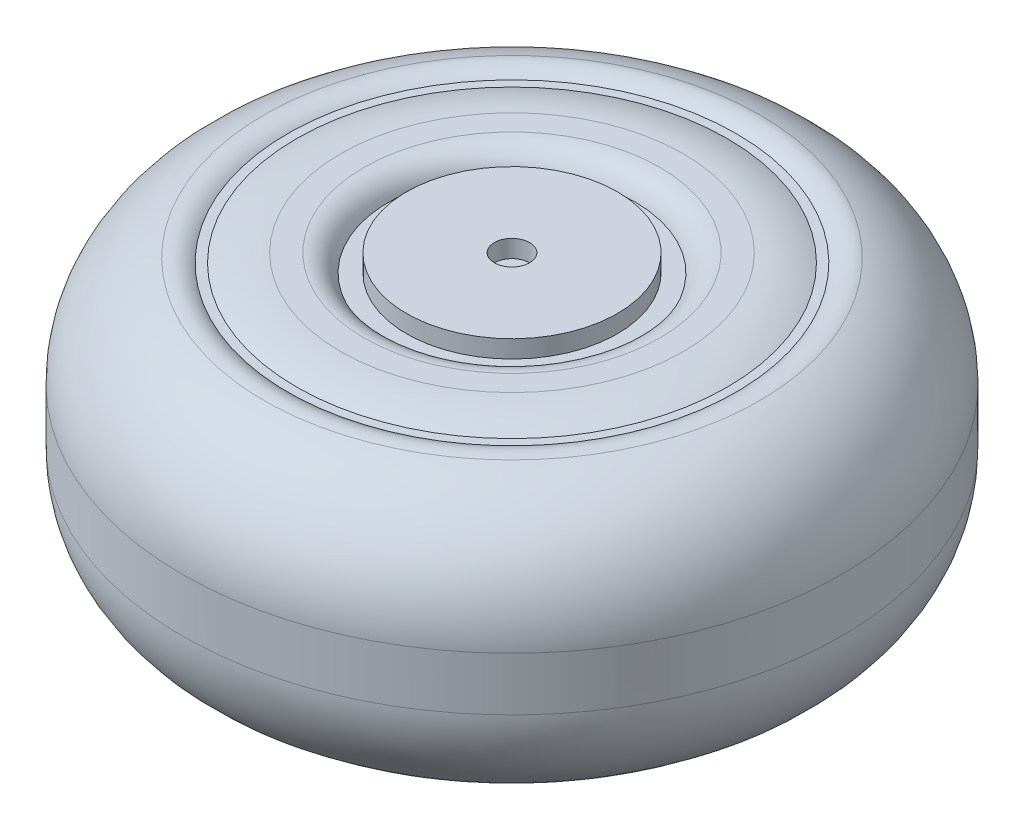
from build123d import *

# Parameters (mm, degrees)
FILLET_1_R = 13
FILLET_2_R = 13
FILLET_3_R = 3
FILLET_4_R = 3


with BuildPart() as part:
    # 草图1 → 旋转1 (revolve)
    with BuildSketch(Plane(origin=(0, 0, 0), x_dir=(0, 0, -1), z_dir=(1, 0, 0)), mode=Mode.PRIVATE) as revolve_1_sk:
        Polygon((25.5, 32), (35.5, 32), (35.5, 30), (37.5, 30), (37.5, 2), (35.5, 2), (35.5, 0), (25.5, 0), (25.5, 2), (23.5, 2), (23.5, 0), (13, 0), (13, 1), (12, 1), (12, 0), (0, 0), (0, 32), (12, 32), (12, 31), (13, 31), (13, 32), (23.5, 32), (23.5, 30), (25.5, 30), align=None)
    revolve(revolve_1_sk.sketch.rotate(Axis((0, 2, -37.5), (0, 1, 0)), 180), axis=Axis((0, 2, -37.5), (0, 1, 0)))

    # 圆角1
    # the kernel refuses this fillet: 13 mm, written as the material it takes off along each edge
    with BuildSketch(Plane(origin=(0, 0, -37.5), x_dir=(0, 0, -1), z_dir=(1, 0, 0))) as fillet_1_piece_1:
        with BuildLine():
            CenterArc((24.5, 12.961481397), FILLET_1_R, 274.411725786, 85.588274214)
            Line((37.5, 12.961481397), (37.76, 12.961481397))
            Line((37.76, 12.961481397), (37.76, 0))
            Line((37.76, 0), (37.5, -0.26))
            ThreePointArc((37.5, -0.26), (31.5, -0.26), (25.52, -0.259229628))
            Line((25.52, -0.259229628), (25.5, 0))
        make_face()
    revolve(axis=Axis((0, 0, -37.5), (0, 1, 0)), mode=Mode.SUBTRACT)
    with BuildSketch(Plane(origin=(0, 32, -37.5), x_dir=(0, 0, -1), z_dir=(1, 0, 0))) as fillet_1_piece_2:
        with BuildLine():
            CenterArc((24.5, -12.961481397), FILLET_1_R, 0, 85.588274214)
            Line((25.5, 0), (25.52, 0.259229628))
            ThreePointArc((25.52, 0.259229628), (31.5, 0.26), (37.5, 0.26))
            Line((37.5, 0.26), (37.76, 0))
            Line((37.76, 0), (37.76, -12.961481397))
            Line((37.76, -12.961481397), (37.5, -12.961481397))
        make_face()
    revolve(axis=Axis((0, 32, -37.5), (0, 1, 0)), mode=Mode.SUBTRACT)

    # 圆角2
    # the kernel refuses this fillet: 13 mm, written as the material it takes off along each edge
    with BuildSketch(Plane(origin=(0, 32, -37.5), x_dir=(0, 0, -1), z_dir=(1, 0, 0))) as fillet_2_piece_1:
        with BuildLine():
            CenterArc((19.5, -13), FILLET_2_R, 67.380135052, 22.619864948)
            Line((24.5, -1), (24.5, 0))
            Line((24.5, 0), (19.5, 0))
        make_face()
    revolve(axis=Axis((0, 32, -37.5), (0, 1, 0)), mode=Mode.SUBTRACT)
    with BuildSketch(Plane(origin=(0, 0, -37.5), x_dir=(0, 0, -1), z_dir=(1, 0, 0))) as fillet_2_piece_2:
        with BuildLine():
            CenterArc((19.5, 13), FILLET_2_R, 270, 22.619864948)
            Line((19.5, 0), (24.5, 0))
            Line((24.5, 0), (24.5, 1))
        make_face()
    revolve(axis=Axis((0, 0, -37.5), (0, 1, 0)), mode=Mode.SUBTRACT)

    # 圆角3
    # the kernel refuses this fillet: 3 mm, written as the material it takes off along each edge
    with BuildSketch(Plane(origin=(0, 32, -37.5), x_dir=(0, 0, -1), z_dir=(1, 0, 0))) as fillet_3_piece_1:
        with BuildLine():
            CenterArc((16.828427125, -3), FILLET_3_R, 90, 70.528779366)
            Line((16.828427125, 0), (16.828427125, 0.06))
            Line((16.828427125, 0.06), (14, 0.06))
            Line((14, 0.06), (13.94, 0))
            ThreePointArc((13.94, 0), (13.94, -1), (13.943431458, -1.98))
            Line((13.943431458, -1.98), (14, -2))
        make_face()
    revolve(axis=Axis((0, 32, -37.5), (0, 1, 0)), mode=Mode.SUBTRACT)

    # 圆角4
    # the kernel refuses this fillet: 3 mm, written as the material it takes off along each edge
    with BuildSketch(Plane(origin=(0, 32, -37.5), x_dir=(0, 0, -1), z_dir=(1, 0, 0))) as fillet_4_piece_1:
        with BuildLine():
            CenterArc((27.336484743, -3.372198092), FILLET_4_R, 73.521921674, 54.224042323)
            Line((28.187430166, -0.495413101), (28.204449075, -0.437877401))
            ThreePointArc((28.204449075, -0.437877401), (26.867646141, -0.117889541), (25.504615385, 0.059822222))
            Line((25.504615385, 0.059822222), (25.44, 0))
            ThreePointArc((25.44, 0), (25.44, -0.5), (25.463270305, -0.952556038))
            Line((25.463270305, -0.952556038), (25.5, -1))
        make_face()
    revolve(axis=Axis((0, 32, -37.5), (0, 1, 0)), mode=Mode.SUBTRACT)


solid = part.part
